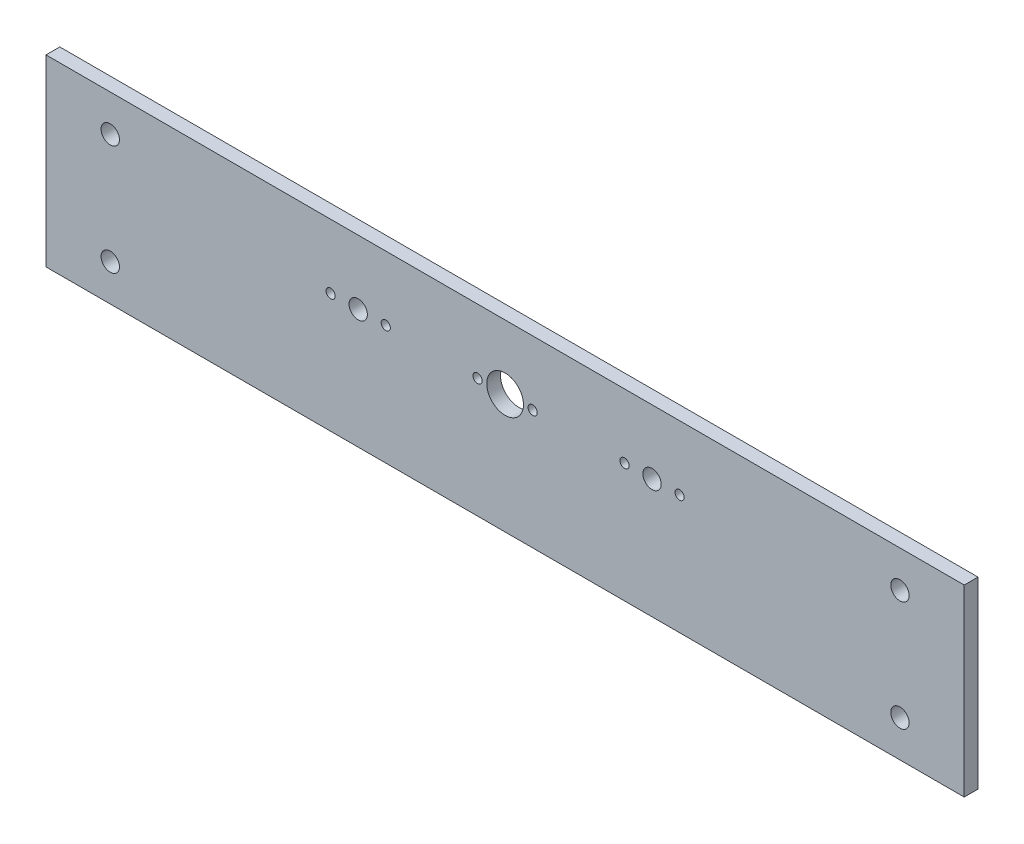
from build123d import *

# Parameters (mm, degrees)
SKETCH2_W           = 500
SKETCH2_H           = 100
BOSS_EXTRUDE1_DEPTH = 7.5
SKETCH9_R           = 5
SKETCH9_R_2         = 2.5
SKETCH9_R_3         = 10
CUT_EXTRUDE3_DEPTH  = 510.957106039
SKETCH11_R          = 5
CUT_EXTRUDE4_DEPTH  = 510.957106039


with BuildPart() as part:
    # Sketch2 → Boss-Extrude1 (new body)
    with BuildSketch(Plane.XY):
        with Locations((250, 50)):
            Rectangle(SKETCH2_W, SKETCH2_H)
    extrude(amount=BOSS_EXTRUDE1_DEPTH)

    # Sketch9 → Cut-Extrude3 (cut, through all)
    with BuildSketch(Plane.XY.offset(7.5)):
        with Locations((170, 65)):
            Circle(SKETCH9_R)
        with Locations((185, 65)):
            Circle(SKETCH9_R_2)
        with Locations((155, 65)):
            Circle(SKETCH9_R_2)
        with Locations((330, 65)):
            Circle(SKETCH9_R)
        with Locations((345, 65)):
            Circle(SKETCH9_R_2)
        with Locations((315, 65)):
            Circle(SKETCH9_R_2)
        with Locations((250, 65)):
            Circle(SKETCH9_R_3)
        with Locations((265, 65)):
            Circle(SKETCH9_R_2)
        with Locations((235, 65)):
            Circle(SKETCH9_R_2)
    extrude(amount=-CUT_EXTRUDE3_DEPTH, mode=Mode.SUBTRACT)

    # Sketch11 → Cut-Extrude4 (cut, through all)
    with BuildSketch(Plane.XY.offset(7.5)):
        with Locations((35, 80)):
            Circle(SKETCH11_R)
        with Locations((35, 20)):
            Circle(SKETCH11_R)
        with Locations((465, 20)):
            Circle(SKETCH11_R)
        with Locations((465, 80)):
            Circle(SKETCH11_R)
    extrude(amount=-CUT_EXTRUDE4_DEPTH, mode=Mode.SUBTRACT)


solid = part.part
